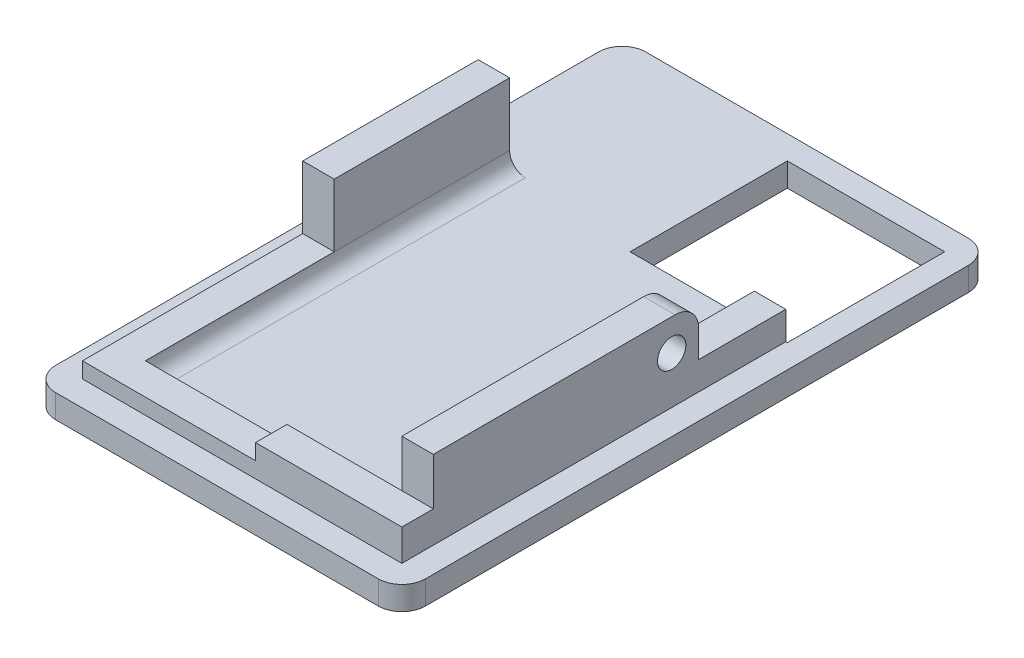
from build123d import *

# Parameters (mm, degrees)
SKETCH_1_W          = 23.5
SKETCH_1_H          = 37.5
EXTRUDE_1_DEPTH     = 1.5
FILLET_1_R          = 1.5
EXTRUDE_2_DEPTH     = 5
SKETCH_3_W          = 2
SKETCH_3_H          = 4
CUT_EXTRUDE_1_DEPTH = 11
SKETCH_4_W          = 2
SKETCH_4_H          = 4
CUT_EXTRUDE_2_DEPTH = 12
SKETCH_5_W          = 2
SKETCH_5_H          = 3
CUT_EXTRUDE_3_DEPTH = 12
FILLET_2_R          = 1
SKETCH_6_R          = 0.9
CUT_EXTRUDE_4_DEPTH = 12
SKETCH_7_W          = 10
SKETCH_7_H          = 10
CUT_EXTRUDE_5_DEPTH = 12
SKETCH_8_W          = 5.533466027
SKETCH_8_H          = 3.21445342
CUT_EXTRUDE_6_DEPTH = 10
FILLET_3_R          = 1.5


with BuildPart() as part:
    # 草图1 → 凸台-拉伸1 (new body)
    with BuildSketch(Plane(origin=(0, 0, 0), x_dir=(1, 0, 0), z_dir=(0, 1, 0))):
        Rectangle(SKETCH_1_W, SKETCH_1_H)
    extrude(amount=EXTRUDE_1_DEPTH)

    # 圆角1
    fillet_1_edges = [part.edges().sort_by_distance(p)[0] for p in [
        (-11.75, 0.75, -18.75),
        (11.75, 0.75, -18.75),
        (11.75, 0.75, 18.75),
        (-11.75, 0.75, 18.75),
    ]]
    fillet(fillet_1_edges, radius=FILLET_1_R)

    # 草图2 → 凸台-拉伸2 (add)
    with BuildSketch(Plane(origin=(0, 1.5, 0), x_dir=(1, 0, 0), z_dir=(0, 1, 0))):
        Polygon((-8.792128206, -17.15), (10.15, -17.15), (10.15, 8), (8.15, 8), (8.15, -15.15), (-8.15, -15.15), (-8.15, 8), (-10.15, 8), (-10.15, -17.15), align=None)
    extrude(amount=EXTRUDE_2_DEPTH)

    # 草图3 → 切除-拉伸1 (cut)
    with BuildSketch(Plane.ZY.offset(10.15)):
        with Locations((16.15, 4.5)):
            Rectangle(SKETCH_3_W, SKETCH_3_H)
    extrude(amount=-CUT_EXTRUDE_1_DEPTH, mode=Mode.SUBTRACT)

    # 草图4 → 切除-拉伸2 (cut)
    with BuildSketch(Plane.XY.offset(15.15)):
        with Locations((-9.15, 4.5)):
            Rectangle(SKETCH_4_W, SKETCH_4_H)
    extrude(amount=-CUT_EXTRUDE_2_DEPTH, mode=Mode.SUBTRACT)

    # 草图5 → 切除-拉伸3 (cut)
    with BuildSketch(Plane.ZY.offset(-0.85)):
        with Locations((16.15, 5)):
            Rectangle(SKETCH_5_W, SKETCH_5_H)
    extrude(amount=-CUT_EXTRUDE_3_DEPTH, mode=Mode.SUBTRACT)

    # 圆角2
    fillet_2_edges = [part.edges().sort_by_distance(p)[0] for p in [
        (0, 1.5, 15.15),
        (-8.15, 1.5, 3.575),
        (8.15, 1.5, 3.575),
    ]]
    fillet(fillet_2_edges, radius=FILLET_2_R - 0.0001)  # a hair under: the kernel refuses the full size

    # 草图6 → 切除-拉伸4 (cut)
    with BuildSketch(Plane(origin=(10.15, 0, 0), x_dir=(0, 0, -1), z_dir=(1, 0, 0))):
        with Locations((0, 4.5)):
            Circle(SKETCH_6_R)
    extrude(amount=-CUT_EXTRUDE_4_DEPTH, mode=Mode.SUBTRACT)

    # 草图7 → 切除-拉伸5 (cut)
    with BuildSketch(Plane.XZ):
        with Locations((5.25, -12.25)):
            Rectangle(SKETCH_7_W, SKETCH_7_H)
    extrude(amount=-CUT_EXTRUDE_5_DEPTH, mode=Mode.SUBTRACT)

    # 草图8 → 切除-拉伸6 (cut)
    with BuildSketch(Plane(origin=(10.15, 0, 0), x_dir=(0, 0, -1), z_dir=(1, 0, 0))):
        with Locations((4.483266987, 4.89277329)):
            Rectangle(SKETCH_8_W, SKETCH_8_H)
    extrude(amount=-CUT_EXTRUDE_6_DEPTH, mode=Mode.SUBTRACT)

    # 圆角3
    fillet_3_edges = [part.edges().sort_by_distance(p)[0] for p in [
        (9.15, 6.5, -1.716533973),
    ]]
    fillet(fillet_3_edges, radius=FILLET_3_R)


solid = part.part
